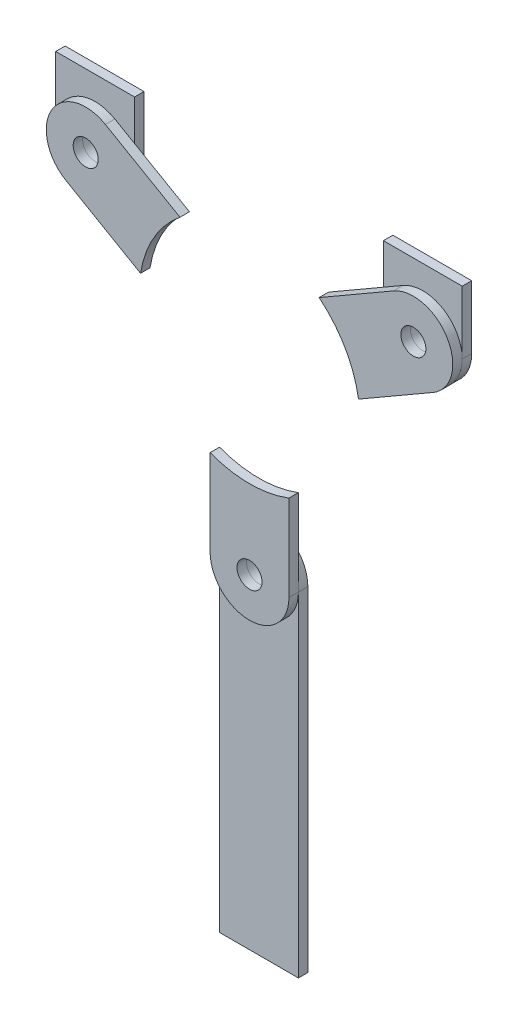
from build123d import *

# Parameters (mm, degrees)
SKETCH1_R             = 3.96875
BOSS_EXTRUDE1_DEPTH   = 3
BOSS_EXTRUDE1_2_DEPTH = 3
BOSS_EXTRUDE1_3_DEPTH = 3
SKETCH2_R             = 3.96875
BOSS_EXTRUDE2_DEPTH   = 3
BOSS_EXTRUDE2_2_DEPTH = 3
BOSS_EXTRUDE2_3_DEPTH = 3


with BuildPart() as part:
    # Sketch1 → Boss-Extrude1 (new body)
    with BuildSketch(Plane.XY):
        with BuildLine():
            ThreePointArc((58.211524227, 19.174682453), (62.786841774, 36.25), (45.711524227, 40.825317547))
            Line((45.711524227, 40.825317547), (22.061879132, 27.171188586))
            ThreePointArc((22.061879132, 27.171188586), (30.310889132, 17.5), (34.561879132, 5.520553491))
            Line((34.561879132, 5.520553491), (58.211524227, 19.174682453))
        make_face()
        with Locations((51.961524227, 30)):
            Circle(SKETCH1_R, mode=Mode.SUBTRACT)
    extrude(amount=BOSS_EXTRUDE1_DEPTH)


with BuildPart() as body_2:
    # Sketch1 → Boss-Extrude1 2 (new body)
    with BuildSketch(Plane.XY):
        with BuildLine():
            ThreePointArc((-12.5, -60), (0, -72.5), (12.5, -60))
            Line((12.5, -60), (12.5, -32.691742077))
            ThreePointArc((12.5, -32.691742077), (0, -35), (-12.5, -32.691742077))
            Line((-12.5, -32.691742077), (-12.5, -60))
        make_face()
        with Locations((0, -60)):
            Circle(SKETCH1_R, mode=Mode.SUBTRACT)
    extrude(amount=BOSS_EXTRUDE1_2_DEPTH)


with BuildPart() as body_3:
    # Sketch1 → Boss-Extrude1 3 (new body)
    with BuildSketch(Plane.XY):
        with BuildLine():
            ThreePointArc((-45.711524227, 40.825317547), (-62.786841774, 36.25), (-58.211524227, 19.174682453))
            Line((-58.211524227, 19.174682453), (-34.561879132, 5.520553491))
            ThreePointArc((-34.561879132, 5.520553491), (-30.310889132, 17.5), (-22.061879132, 27.171188586))
            Line((-22.061879132, 27.171188586), (-45.711524227, 40.825317547))
        make_face()
        with Locations((-51.961524227, 30)):
            Circle(SKETCH1_R, mode=Mode.SUBTRACT)
    extrude(amount=BOSS_EXTRUDE1_3_DEPTH)


with BuildPart() as body_4:
    # Sketch2 → Boss-Extrude2 (new body)
    with BuildSketch(Plane.XY):
        with BuildLine():
            Line((-64.461524227, 30), (-64.461524227, 50))
            Line((-64.461524227, 50), (-39.461524227, 50))
            Line((-39.461524227, 50), (-39.461524227, 30))
            ThreePointArc((-39.461524227, 30), (-51.961524227, 17.5), (-64.461524227, 30))
        make_face()
        with Locations((-51.961524227, 30)):
            Circle(SKETCH2_R, mode=Mode.SUBTRACT)
    extrude(amount=-BOSS_EXTRUDE2_DEPTH)


with BuildPart() as body_5:
    # Sketch2 → Boss-Extrude2 2 (new body)
    with BuildSketch(Plane.XY):
        with BuildLine():
            Line((64.461524227, 30), (64.461524227, 50))
            Line((64.461524227, 50), (39.461524227, 50))
            Line((39.461524227, 50), (39.461524227, 30))
            ThreePointArc((39.461524227, 30), (51.961524227, 17.5), (64.461524227, 30))
        make_face()
        with Locations((51.961524227, 30)):
            Circle(SKETCH2_R, mode=Mode.SUBTRACT)
    extrude(amount=-BOSS_EXTRUDE2_2_DEPTH)


with BuildPart() as body_6:
    # Sketch2 → Boss-Extrude2 3 (new body)
    with BuildSketch(Plane.XY):
        with BuildLine():
            Line((-12.5, -60), (-12.5, -166))
            Line((-12.5, -166), (12.5, -166))
            Line((12.5, -166), (12.5, -60))
            ThreePointArc((12.5, -60), (0, -47.5), (-12.5, -60))
        make_face()
        with Locations((0, -60)):
            Circle(SKETCH2_R, mode=Mode.SUBTRACT)
    extrude(amount=-BOSS_EXTRUDE2_3_DEPTH)


solid = Compound([part.part, body_2.part, body_3.part, body_4.part, body_5.part, body_6.part])
